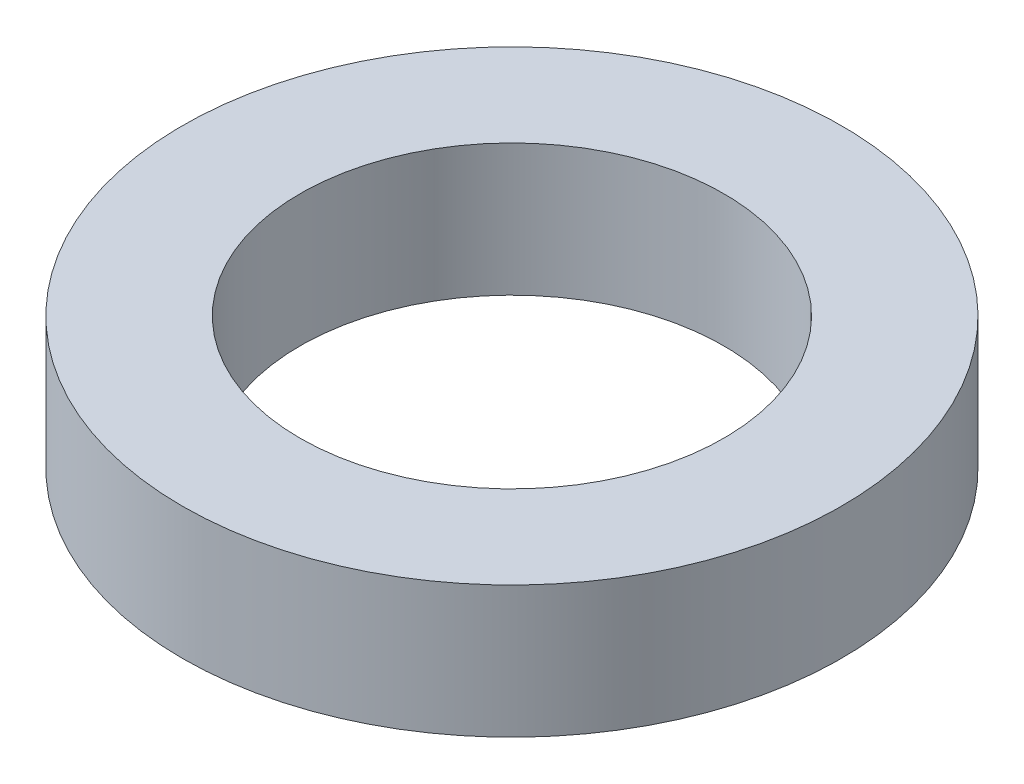
from build123d import *

# Parameters (mm, degrees)
SKETCH1_R           = 35
BOSS_EXTRUDE1_DEPTH = 14
SKETCH2_R           = 22.5
CUT_EXTRUDE1_DEPTH  = 52.439284598


with BuildPart() as part:
    # Sketch1 → Boss-Extrude1 (new body)
    with BuildSketch(Plane(origin=(0, 0, 0), x_dir=(1, 0, 0), z_dir=(0, 1, 0))):
        Circle(SKETCH1_R)
    extrude(amount=BOSS_EXTRUDE1_DEPTH)

    # Sketch2 → Cut-Extrude1 (cut, through all)
    with BuildSketch(Plane(origin=(0, 0, 0), x_dir=(1, 0, 0), z_dir=(0, 1, 0))):
        Circle(SKETCH2_R)
    extrude(amount=CUT_EXTRUDE1_DEPTH, mode=Mode.SUBTRACT)


solid = part.part
